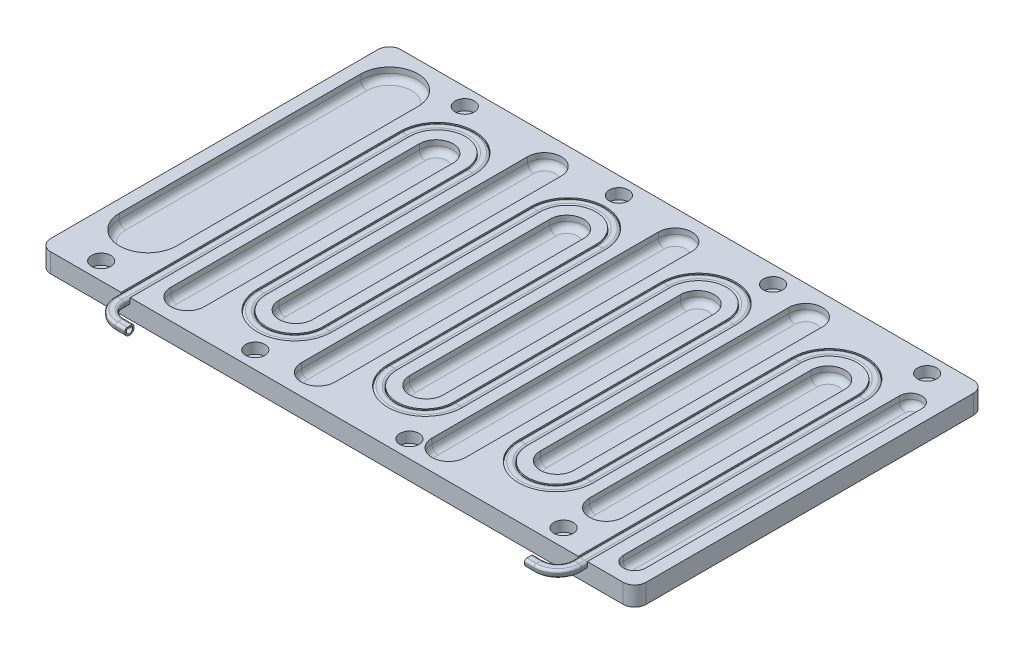
from build123d import *

# Parameters (mm, degrees)
SKETCH1_W                      = 310
SKETCH1_H                      = 182.3
BOSS_EXTRUDE1_DEPTH            = 10
CBORE_FOR_M5_SHCS1_D           = 5.5
CBORE_FOR_M5_SHCS1_CBORE_D     = 10
CBORE_FOR_M5_SHCS1_CBORE_DEPTH = 5.5
FILLET1_R                      = 6
CUT_EXTRUDE1_DEPTH             = 6
FILLET2_R                      = 3.175


with BuildPart() as part:
    # Sketch1 → Boss-Extrude1 (new body)
    with BuildSketch(Plane(origin=(0, 0, 0), x_dir=(1, 0, 0), z_dir=(0, 1, 0))):
        Rectangle(SKETCH1_W, SKETCH1_H)
    extrude(amount=BOSS_EXTRUDE1_DEPTH)

    # CBORE for M5 SHCS1 (through all)
    with Locations(Plane(origin=(0, 10, 0), x_dir=(1, 0, 0), z_dir=(0, 1, 0))):
        with Locations((-131.75, -82.15), (-106.75, 82.15), (-26.5, 82.15), (53.75, 82.15), (134, 82.15), (-51.5, -82.15), (28.75, -82.15), (109, -82.15)):
            CounterBoreHole(CBORE_FOR_M5_SHCS1_D / 2, CBORE_FOR_M5_SHCS1_CBORE_D / 2, CBORE_FOR_M5_SHCS1_CBORE_DEPTH)

    # Fillet1
    fillet1_edges = [part.edges().sort_by_distance(p)[0] for p in [
        (155, 5, -91.15),
        (155, 5, 91.15),
        (-155, 5, -91.15),
        (-155, 5, 91.15),
    ]]
    fillet(fillet1_edges, radius=FILLET1_R)

    # Cut-Sweep1: sweep along a path in Sketch6
    with BuildLine(Plane(origin=(0, 10, 0), x_dir=(1, 0, 0), z_dir=(0, 1, 0))) as cut_sweep1_path:
        Line((-95, -104.15), (-100, -104.15))
        ThreePointArc((-100, -104.15), (-107.071067812, -101.221067812), (-110, -94.15))
        Line((-110, -94.15), (-110, -91.15))
        Line((-110, -91.15), (-110, 54.15))
        ThreePointArc((-110, 54.15), (-93, 71.15), (-76, 54.15))
        Line((-76, 54.15), (-76, -54.15))
        ThreePointArc((-76, -54.15), (-59, -71.15), (-42, -54.15))
        Line((-42, -54.15), (-42, 54.15))
        ThreePointArc((-42, 54.15), (-25, 71.15), (-8, 54.15))
        Line((-8, 54.15), (-8, -54.15))
        ThreePointArc((-8, -54.15), (9, -71.15), (26, -54.15))
        Line((26, -54.15), (26, 54.15))
        ThreePointArc((26, 54.15), (43, 71.15), (60, 54.15))
        Line((60, 54.15), (60, -54.15))
        ThreePointArc((60, -54.15), (77, -71.15), (94, -54.15))
        Line((94, -54.15), (94, 54.15))
        ThreePointArc((94, 54.15), (111, 71.15), (128, 54.15))
        Line((128, 54.15), (128, -91.15))
        Line((128, -91.15), (128, -94.15))
        ThreePointArc((128, -94.15), (125.071067812, -101.221067812), (118, -104.15))
        Line((118, -104.15), (113, -104.15))
    # Sketch7 → Cut-Sweep1 (sweep, cut)
    with BuildSketch(Plane.XY.offset(91.15)):
        with BuildLine():
            Line((-112.38125, 8.2), (-112.38125, 10))
            Line((-112.38125, 10), (-107.61875, 10))
            Line((-107.61875, 10), (-107.61875, 8.2))
            ThreePointArc((-107.61875, 8.2), (-110, 5.81875), (-112.38125, 8.2))
        make_face()
    sweep(path=cut_sweep1_path.line, mode=Mode.SUBTRACT)

    # Sketch9 → Cut-Extrude1 (cut)
    with BuildSketch(Plane(origin=(0, 10, 0), x_dir=(1, 0, 0), z_dir=(0, 1, 0))):
        with BuildLine():
            Line((-148.5, 69.840625), (-148.5, -55.840625))
            ThreePointArc((-148.5, -55.840625), (-133.690625, -70.65), (-118.88125, -55.840625))
            Line((-118.88125, -55.840625), (-118.88125, 69.840625))
            ThreePointArc((-118.88125, 69.840625), (-133.690625, 84.65), (-148.5, 69.840625))
        make_face()
        with BuildLine():
            Line((-101.75, 53.51875), (-101.75, -75.9))
            ThreePointArc((-101.75, -75.9), (-93, -84.65), (-84.25, -75.9))
            Line((-84.25, -75.9), (-84.25, 53.51875))
            ThreePointArc((-84.25, 53.51875), (-93, 62.26875), (-101.75, 53.51875))
        make_face()
        with BuildLine():
            Line((-67.75, 75.9), (-67.75, -53.51875))
            ThreePointArc((-67.75, -53.51875), (-59, -62.26875), (-50.25, -53.51875))
            Line((-50.25, -53.51875), (-50.25, 75.9))
            ThreePointArc((-50.25, 75.9), (-59, 84.65), (-67.75, 75.9))
        make_face()
        with BuildLine():
            Line((-33.75, -75.9), (-33.75, 53.51875))
            ThreePointArc((-33.75, 53.51875), (-25, 62.26875), (-16.25, 53.51875))
            Line((-16.25, 53.51875), (-16.25, -75.9))
            ThreePointArc((-16.25, -75.9), (-25, -84.65), (-33.75, -75.9))
        make_face()
        with BuildLine():
            Line((0.25, 75.9), (0.25, -53.51875))
            ThreePointArc((0.25, -53.51875), (9, -62.26875), (17.75, -53.51875))
            Line((17.75, -53.51875), (17.75, 75.9))
            ThreePointArc((17.75, 75.9), (9, 84.65), (0.25, 75.9))
        make_face()
        with BuildLine():
            Line((34.25, -75.9), (34.25, 53.51875))
            ThreePointArc((34.25, 53.51875), (43, 62.26875), (51.75, 53.51875))
            Line((51.75, 53.51875), (51.75, -75.9))
            ThreePointArc((51.75, -75.9), (43, -84.65), (34.25, -75.9))
        make_face()
        with BuildLine():
            Line((68.25, 75.9), (68.25, -53.51875))
            ThreePointArc((68.25, -53.51875), (77, -62.26875), (85.75, -53.51875))
            Line((85.75, -53.51875), (85.75, 75.9))
            ThreePointArc((85.75, 75.9), (77, 84.65), (68.25, 75.9))
        make_face()
        with BuildLine():
            Line((102.25, -61.9), (102.25, 53.51875))
            ThreePointArc((102.25, 53.51875), (111, 62.26875), (119.75, 53.51875))
            Line((119.75, 53.51875), (119.75, -61.9))
            ThreePointArc((119.75, -61.9), (111, -70.65), (102.25, -61.9))
        make_face()
        with BuildLine():
            Line((136.88125, 64.840625), (136.88125, -78.840625))
            ThreePointArc((136.88125, -78.840625), (142.690625, -84.65), (148.5, -78.840625))
            Line((148.5, -78.840625), (148.5, 64.840625))
            ThreePointArc((148.5, 64.840625), (142.690625, 70.65), (136.88125, 64.840625))
        make_face()
    extrude(amount=-CUT_EXTRUDE1_DEPTH, mode=Mode.SUBTRACT)

    # Fillet2
    fillet2_edges = [part.edges().sort_by_distance(p)[0] for p in [
        (148.5, 4, 7),
        (142.690625, 4, 84.65),
        (136.88125, 4, 7),
        (142.690625, 4, -70.65),
        (102.25, 4, 4.190625),
        (111, 4, -62.26875),
        (119.75, 4, 4.190625),
        (111, 4, 70.65),
        (85.75, 4, -11.190625),
        (77, 4, 62.26875),
        (68.25, 4, -11.190625),
        (77, 4, -84.65),
        (34.25, 4, 11.190625),
        (43, 4, -62.26875),
        (51.75, 4, 11.190625),
        (43, 4, 84.65),
        (17.75, 4, -11.190625),
        (9, 4, 62.26875),
        (0.25, 4, -11.190625),
        (9, 4, -84.65),
        (-33.75, 4, 11.190625),
        (-25, 4, -62.26875),
        (-16.25, 4, 11.190625),
        (-25, 4, 84.65),
        (-50.25, 4, -11.190625),
        (-59, 4, 62.26875),
        (-67.75, 4, -11.190625),
        (-59, 4, -84.65),
        (-84.25, 4, 11.190625),
        (-93, 4, 84.65),
        (-101.75, 4, 11.190625),
        (-93, 4, -62.26875),
        (-118.88125, 4, -7),
        (-133.690625, 4, 70.65),
        (-148.5, 4, -7),
        (-133.690625, 4, -84.65),
    ]]
    fillet(fillet2_edges, radius=FILLET2_R)


with BuildPart() as body_2:
    # Sweep1: sweep along a path in Sketch6<2>
    with BuildLine(Plane(origin=(0, 10, 0), x_dir=(1, 0, 0), z_dir=(0, 1, 0))) as sweep1_path:
        Line((-95, -104.15), (-100, -104.15))
        ThreePointArc((-100, -104.15), (-107.071067812, -101.221067812), (-110, -94.15))
        Line((-110, -94.15), (-110, -91.15))
        Line((-110, -91.15), (-110, 54.15))
        ThreePointArc((-110, 54.15), (-93, 71.15), (-76, 54.15))
        Line((-76, 54.15), (-76, -54.15))
        ThreePointArc((-76, -54.15), (-59, -71.15), (-42, -54.15))
        Line((-42, -54.15), (-42, 54.15))
        ThreePointArc((-42, 54.15), (-25, 71.15), (-8, 54.15))
        Line((-8, 54.15), (-8, -54.15))
        ThreePointArc((-8, -54.15), (9, -71.15), (26, -54.15))
        Line((26, -54.15), (26, 54.15))
        ThreePointArc((26, 54.15), (43, 71.15), (60, 54.15))
        Line((60, 54.15), (60, -54.15))
        ThreePointArc((60, -54.15), (77, -71.15), (94, -54.15))
        Line((94, -54.15), (94, 54.15))
        ThreePointArc((94, 54.15), (111, 71.15), (128, 54.15))
        Line((128, 54.15), (128, -91.15))
        Line((128, -91.15), (128, -94.15))
        ThreePointArc((128, -94.15), (125.071067812, -101.221067812), (118, -104.15))
        Line((118, -104.15), (113, -104.15))
    # Sketch8 → Sweep1 (sweep)
    with BuildSketch(Plane.XY.offset(91.15)):
        with BuildLine():
            Line((-112.38125, 8.2), (-112.38125, 8.75))
            ThreePointArc((-112.38125, 8.75), (-112.015133476, 9.633883476), (-111.13125, 10))
            Line((-111.13125, 10), (-108.86875, 10))
            ThreePointArc((-108.86875, 10), (-107.984866524, 9.633883476), (-107.61875, 8.75))
            Line((-107.61875, 8.75), (-107.61875, 8.2))
            ThreePointArc((-107.61875, 8.2), (-110, 5.81875), (-112.38125, 8.2))
        make_face()
        with BuildLine():
            Line((-111.61925, 8.2), (-111.61925, 8.838))
            ThreePointArc((-111.61925, 8.838), (-111.502092712, 9.120842712), (-111.21925, 9.238))
            Line((-111.21925, 9.238), (-108.78075, 9.238))
            ThreePointArc((-108.78075, 9.238), (-108.497907288, 9.120842712), (-108.38075, 8.838))
            Line((-108.38075, 8.838), (-108.38075, 8.2))
            ThreePointArc((-108.38075, 8.2), (-110, 6.58075), (-111.61925, 8.2))
        make_face(mode=Mode.SUBTRACT)
    sweep(path=sweep1_path.line)


solid = Compound([part.part, body_2.part])
